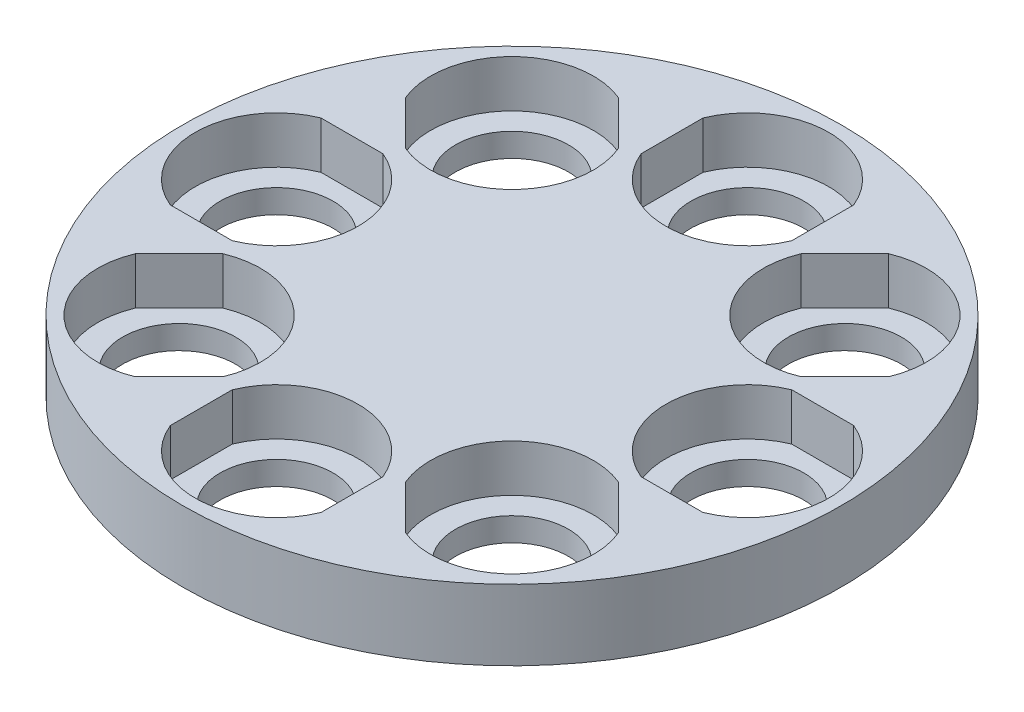
from build123d import *

# Parameters (mm, degrees)
SKETCH1_R           = 70
SKETCH1_R_2         = 12
BOSS_EXTRUDE1_DEPTH = 25
CUT_EXTRUDE1_DEPTH  = 10
SKETCH3_R           = 20
CUT_EXTRUDE2_DEPTH  = 7.5


with BuildPart() as part:
    # Sketch1 → Boss-Extrude1 (new body)
    with BuildSketch(Plane(origin=(0, 0, 0), x_dir=(1, 0, 0), z_dir=(0, 1, 0))):
        Circle(SKETCH1_R)
        with Locations((50, 0)):
            Circle(SKETCH1_R_2, mode=Mode.SUBTRACT)
        with Locations((35.355339059, -35.355339059)):
            Circle(SKETCH1_R_2, mode=Mode.SUBTRACT)
        with Locations((0, -50)):
            Circle(SKETCH1_R_2, mode=Mode.SUBTRACT)
        with Locations((-35.355339059, -35.355339059)):
            Circle(SKETCH1_R_2, mode=Mode.SUBTRACT)
        with Locations((-50, 0)):
            Circle(SKETCH1_R_2, mode=Mode.SUBTRACT)
        with Locations((-35.355339059, 35.355339059)):
            Circle(SKETCH1_R_2, mode=Mode.SUBTRACT)
        with Locations((0, 50)):
            Circle(SKETCH1_R_2, mode=Mode.SUBTRACT)
        with Locations((35.355339059, 35.355339059)):
            Circle(SKETCH1_R_2, mode=Mode.SUBTRACT)
    extrude(amount=BOSS_EXTRUDE1_DEPTH)

    # Sketch2 → Cut-Extrude1 (cut)
    with BuildSketch(Plane(origin=(0, 25, 0), x_dir=(1, 0, 0), z_dir=(0, 1, 0))):
        with BuildLine():
            Line((50, 16), (43.42048634, 16))
            ThreePointArc((43.42048634, 16), (32.7, 0), (43.42048634, -16))
            Line((43.42048634, -16), (50, -16))
            Line((50, -16), (56.57951366, -16))
            ThreePointArc((56.57951366, -16), (67.3, 0), (56.57951366, 16))
            Line((56.57951366, 16), (50, 16))
        make_face()
        with BuildLine():
            Line((46.669047558, -24.04163056), (42.016628833, -19.389211835))
            ThreePointArc((42.016628833, -19.389211835), (23.122391745, -23.122391745), (19.389211835, -42.016628833))
            Line((19.389211835, -42.016628833), (24.04163056, -46.669047558))
            Line((24.04163056, -46.669047558), (28.694049286, -51.321466284))
            ThreePointArc((28.694049286, -51.321466284), (47.588286374, -47.588286374), (51.321466284, -28.694049286))
            Line((51.321466284, -28.694049286), (46.669047558, -24.04163056))
        make_face()
        with BuildLine():
            Line((16, -50), (16, -43.42048634))
            ThreePointArc((16, -43.42048634), (0, -32.7), (-16, -43.42048634))
            Line((-16, -43.42048634), (-16, -50))
            Line((-16, -50), (-16, -56.57951366))
            ThreePointArc((-16, -56.57951366), (0, -67.3), (16, -56.57951366))
            Line((16, -56.57951366), (16, -50))
        make_face()
        with BuildLine():
            Line((-24.04163056, -46.669047558), (-19.389211835, -42.016628833))
            ThreePointArc((-19.389211835, -42.016628833), (-23.122391745, -23.122391745), (-42.016628833, -19.389211835))
            Line((-42.016628833, -19.389211835), (-46.669047558, -24.04163056))
            Line((-46.669047558, -24.04163056), (-51.321466284, -28.694049286))
            ThreePointArc((-51.321466284, -28.694049286), (-47.588286374, -47.588286374), (-28.694049286, -51.321466284))
            Line((-28.694049286, -51.321466284), (-24.04163056, -46.669047558))
        make_face()
        with BuildLine():
            Line((-50, -16), (-43.42048634, -16))
            ThreePointArc((-43.42048634, -16), (-32.7, 0), (-43.42048634, 16))
            Line((-43.42048634, 16), (-50, 16))
            Line((-50, 16), (-56.57951366, 16))
            ThreePointArc((-56.57951366, 16), (-67.3, 0), (-56.57951366, -16))
            Line((-56.57951366, -16), (-50, -16))
        make_face()
        with BuildLine():
            Line((-46.669047558, 24.04163056), (-42.016628833, 19.389211835))
            ThreePointArc((-42.016628833, 19.389211835), (-23.122391745, 23.122391745), (-19.389211835, 42.016628833))
            Line((-19.389211835, 42.016628833), (-24.04163056, 46.669047558))
            Line((-24.04163056, 46.669047558), (-28.694049286, 51.321466284))
            ThreePointArc((-28.694049286, 51.321466284), (-47.588286374, 47.588286374), (-51.321466284, 28.694049286))
            Line((-51.321466284, 28.694049286), (-46.669047558, 24.04163056))
        make_face()
        with BuildLine():
            Line((-16, 50), (-16, 43.42048634))
            ThreePointArc((-16, 43.42048634), (0, 32.7), (16, 43.42048634))
            Line((16, 43.42048634), (16, 50))
            Line((16, 50), (16, 56.57951366))
            ThreePointArc((16, 56.57951366), (0, 67.3), (-16, 56.57951366))
            Line((-16, 56.57951366), (-16, 50))
        make_face()
        with BuildLine():
            Line((24.04163056, 46.669047558), (19.389211835, 42.016628833))
            ThreePointArc((19.389211835, 42.016628833), (23.122391745, 23.122391745), (42.016628833, 19.389211835))
            Line((42.016628833, 19.389211835), (46.669047558, 24.04163056))
            Line((46.669047558, 24.04163056), (51.321466284, 28.694049286))
            ThreePointArc((51.321466284, 28.694049286), (47.588286374, 47.588286374), (28.694049286, 51.321466284))
            Line((28.694049286, 51.321466284), (24.04163056, 46.669047558))
        make_face()
    extrude(amount=-CUT_EXTRUDE1_DEPTH, mode=Mode.SUBTRACT)


with BuildPart() as body_2:
    # Split1: the piece on the far side of the plane
    add(part.part)
    split(bisect_by=Plane.ZX.offset(10), keep=Keep.BOTTOM)


with BuildPart() as part_1:
    add(part.part)

    # Split1
    split(bisect_by=Plane.ZX.offset(10), keep=Keep.TOP)

    # Sketch3 → Cut-Extrude2 (cut)
    with BuildSketch(Plane.XZ.offset(-10)):
        Circle(SKETCH3_R)
    extrude(amount=-CUT_EXTRUDE2_DEPTH, mode=Mode.SUBTRACT)


solid = part_1.part
